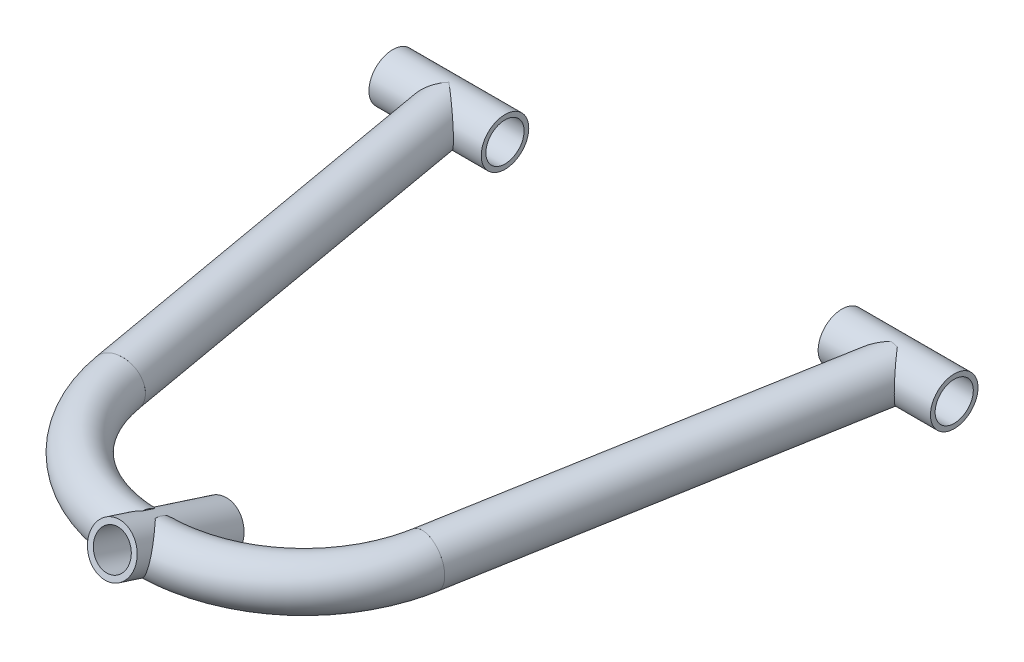
from build123d import *

# Parameters (mm, degrees)
AL_START                                       = -169.337399118
AL_ROUND_TUBING_25_4MM_OD_2_5MM_WALL_2_R       = 12.7
AL_ROUND_TUBING_25_4MM_OD_2_5MM_WALL_2_R_2     = 10.2
AL_ROUND_TUBING_25_4MM_OD_2_5MM_WALL_THI_DEPTH = 215.815587893
AL_ROUND_TUBING_25_4MM_OD_2_5MM_WALL_3_O_R     = 12.7
AL_ROUND_TUBING_25_4MM_OD_2_5MM_WALL_3_O_R_2   = 10.2
AL_ROUND_TUBING_25_4MM_OD_2_5MM_WALL_3_ANGLE   = 80
AL_ROUND_TUBING_25_4MM_OD_2_5MM_WALL_4_O_R     = 12.7
AL_ROUND_TUBING_25_4MM_OD_2_5MM_WALL_4_O_R_2   = 10.2
AL_ROUND_TUBING_25_4MM_OD_2_5MM_WALL_4_ANGLE   = 80
AL_START_2                                     = 6.947512144
AL_ROUND_TUBING_25_4MM_OD_2_5MM_WALL_5_O_R     = 12.7
AL_ROUND_TUBING_25_4MM_OD_2_5MM_WALL_5_O_R_2   = 10.2
AL_ROUND_TUBING_25_4MM_OD_2_5MM_WALL_5_DEPTH   = 217.960474667
AL_START_3                                     = 27
AL_ROUND_TUBING_25_4MM_OD_2_5MM_WALL_6_DEPTH   = 29
AL_START_4                                     = 250.00912844
AL_ROUND_TUBING_25_4MM_OD_2_5MM_WALL_7_O_R     = 12.7
AL_ROUND_TUBING_25_4MM_OD_2_5MM_WALL_7_O_R_2   = 10.2
AL_ROUND_TUBING_25_4MM_OD_2_5MM_WALL_7_DEPTH   = 60
AL_START_5                                     = 10.00912844
AL_ROUND_TUBING_25_4MM_OD_2_5MM_WALL_8_O_R     = 12.7
AL_ROUND_TUBING_25_4MM_OD_2_5MM_WALL_8_O_R_2   = 10.2
AL_ROUND_TUBING_25_4MM_OD_2_5MM_WALL_8_DEPTH   = 60
AL_START_6                                     = 156.642187893
AL_ROUND_TUBING_25_4MM_OD_2_5MM_WALL_9_O_R     = 12.7
AL_ROUND_TUBING_25_4MM_OD_2_5MM_WALL_9_O_R_2   = 10.2
AL_ROUND_TUBING_25_4MM_OD_2_5MM_WALL_9_DEPTH   = 6.733880298
SKETCH1_R                                      = 12.7
SKETCH1_R_2                                    = 9.7
AL_ROUND_TUBING_25_4MM_OD_3MM_WALL_THICK_DEPTH = 60
SKETCH111_R                                    = 9.7
CUT_EXTRUDE1_DEPTH                             = 79
SKETCH112_R                                    = 12.7
CUT_EXTRUDE2_DEPTH                             = 79
SKETCH113_R                                    = 10.7
CUT_EXTRUDE3_DEPTH                             = 79
SKETCH114_R                                    = 12.7
CUT_EXTRUDE4_DEPTH                             = 79
SKETCH151_R                                    = 12.7
SKETCH151_R_2                                  = 10.2
AL_ROUND_TUBING_25_4MM_OD_2_5MM_WALL_10_DEPTH  = 49.557519174
CUT_EXTRUDE8_DEPTH                             = 437.573037809
CUT_EXTRUDE8_DEPTH_BACK                        = 437.573037809
SKETCH152_R                                    = 12.7


with BuildPart() as part:
    # Al round tubing 25.4MM_OD_2.5MM_WALL_THI: read off the stored shape, not the designer's step
    # Al round tubing 25.4MM_OD_2.5MM_WALL 2 → Al round tubing 25.4MM_OD_2.5MM_WALL_THI (new body)
    with BuildSketch(Plane(origin=(0, 0, 0), x_dir=(0.9848077523877098, 0, 0.17364818120863598), z_dir=(0.17364818120863598, 0, -0.9848077523877098)).offset(AL_START)):
        with Locations((275.755160427, 0)):
            Circle(AL_ROUND_TUBING_25_4MM_OD_2_5MM_WALL_2_R)
        with Locations((275.755160427, 0)):
            Circle(AL_ROUND_TUBING_25_4MM_OD_2_5MM_WALL_2_R_2, mode=Mode.SUBTRACT)
    extrude(amount=AL_ROUND_TUBING_25_4MM_OD_2_5MM_WALL_THI_DEPTH)

    # Sketch113 → Cut-Extrude3 (cut)
    with BuildSketch(Plane(origin=(310.00912844, 0, 0), x_dir=(0, 0, -1), z_dir=(1, 0, 0))):
        Circle(SKETCH113_R)
    extrude(amount=-CUT_EXTRUDE3_DEPTH, mode=Mode.SUBTRACT)

    # Sketch114 → Cut-Extrude4 (cut)
    with BuildSketch(Plane(origin=(310.00912844, 0, 0), x_dir=(0, 0, -1), z_dir=(1, 0, 0))):
        Circle(SKETCH114_R)
    extrude(amount=-CUT_EXTRUDE4_DEPTH, mode=Mode.SUBTRACT)


with BuildPart() as body_2:
    # Al round tubing 25.4MM_OD_2.5MM_WALL 3 o → Al round tubing 25.4MM_OD_2.5MM_WALL 3 (revolve)
    with BuildSketch(Plane(origin=(163.376068191, 0, 200.757310991), x_dir=(0, 0, 1), z_dir=(-1, 0, 0))):
        with Locations((80, 0)):
            Circle(AL_ROUND_TUBING_25_4MM_OD_2_5MM_WALL_3_O_R)
        with Locations((80, 0)):
            Circle(AL_ROUND_TUBING_25_4MM_OD_2_5MM_WALL_3_O_R_2, mode=Mode.SUBTRACT)
    revolve(axis=Axis((163.376068191, 0, 200.757310991), (0, 1, 0)), revolution_arc=AL_ROUND_TUBING_25_4MM_OD_2_5MM_WALL_3_ANGLE)


with BuildPart() as body_3:
    # Al round tubing 25.4MM_OD_2.5MM_WALL 4 o → Al round tubing 25.4MM_OD_2.5MM_WALL 4 (revolve)
    with BuildSketch(Plane(origin=(156.642187893, 0, 200.757310991), x_dir=(-0.9848077530122088, 0, 0.1736481776669259), z_dir=(-0.1736481776669259, 0, -0.9848077530122088))):
        with Locations((80, 0)):
            Circle(AL_ROUND_TUBING_25_4MM_OD_2_5MM_WALL_4_O_R)
        with Locations((80, 0)):
            Circle(AL_ROUND_TUBING_25_4MM_OD_2_5MM_WALL_4_O_R_2, mode=Mode.SUBTRACT)
    revolve(axis=Axis((156.642187893, 0, 200.757310991), (0, 1, 0)), revolution_arc=AL_ROUND_TUBING_25_4MM_OD_2_5MM_WALL_4_ANGLE)


with BuildPart() as body_4:
    # Al round tubing 25.4MM_OD_2.5MM_WALL 5 o → Al round tubing 25.4MM_OD_2.5MM_WALL 5 (new body)
    with BuildSketch(Plane(origin=(0, 0, 0), x_dir=(0.9848077530122086, 0, -0.173648177666927), z_dir=(0.17364817766692697, 0, 0.9848077530122088)).offset(AL_START_2)):
        with Locations((39.401299879, 0)):
            Circle(AL_ROUND_TUBING_25_4MM_OD_2_5MM_WALL_5_O_R)
        with Locations((39.401299879, 0)):
            Circle(AL_ROUND_TUBING_25_4MM_OD_2_5MM_WALL_5_O_R_2, mode=Mode.SUBTRACT)
    extrude(amount=AL_ROUND_TUBING_25_4MM_OD_2_5MM_WALL_5_DEPTH)

    # Al round tubing 25.4MM_OD_2.5MM_WALL 6 o → Al round tubing 25.4MM_OD_2.5MM_WALL 6 (cut)
    with BuildSketch(Plane.YZ.offset(AL_START_3)):
        with BuildLine():
            ThreePointArc((12.7, 0), (0, 12.7), (-12.7, 0))
            Line((-12.7, 0), (-12.7, -4))
            Line((-12.7, -4), (12.7, -4))
            Line((12.7, -4), (12.7, 0))
        make_face()
    extrude(amount=AL_ROUND_TUBING_25_4MM_OD_2_5MM_WALL_6_DEPTH, mode=Mode.SUBTRACT)


with BuildPart() as body_5:
    # Al round tubing 25.4MM_OD_2.5MM_WALL 7 o → Al round tubing 25.4MM_OD_2.5MM_WALL 7 (new body)
    with BuildSketch(Plane.YZ.offset(AL_START_4)):
        Circle(AL_ROUND_TUBING_25_4MM_OD_2_5MM_WALL_7_O_R)
        Circle(AL_ROUND_TUBING_25_4MM_OD_2_5MM_WALL_7_O_R_2, mode=Mode.SUBTRACT)
    extrude(amount=AL_ROUND_TUBING_25_4MM_OD_2_5MM_WALL_7_DEPTH)


with BuildPart() as body_6:
    # Al round tubing 25.4MM_OD_2.5MM_WALL 8 o → Al round tubing 25.4MM_OD_2.5MM_WALL 8 (new body)
    with BuildSketch(Plane.YZ.offset(AL_START_5)):
        Circle(AL_ROUND_TUBING_25_4MM_OD_2_5MM_WALL_8_O_R)
        Circle(AL_ROUND_TUBING_25_4MM_OD_2_5MM_WALL_8_O_R_2, mode=Mode.SUBTRACT)
    extrude(amount=AL_ROUND_TUBING_25_4MM_OD_2_5MM_WALL_8_DEPTH)


with BuildPart() as body_7:
    # Al round tubing 25.4MM_OD_2.5MM_WALL 9 o → Al round tubing 25.4MM_OD_2.5MM_WALL 9 (new body)
    with BuildSketch(Plane.YZ.offset(AL_START_6)):
        with Locations((0, 280.757310991)):
            Circle(AL_ROUND_TUBING_25_4MM_OD_2_5MM_WALL_9_O_R)
        with Locations((0, 280.757310991)):
            Circle(AL_ROUND_TUBING_25_4MM_OD_2_5MM_WALL_9_O_R_2, mode=Mode.SUBTRACT)
    extrude(amount=AL_ROUND_TUBING_25_4MM_OD_2_5MM_WALL_9_DEPTH)


with BuildPart() as body_8:
    # Sketch1 → Al round tubing 25.4MM_OD_3MM_WALL_THICKNESS(2) (new body)
    with BuildSketch(Plane(origin=(160.00912844, 6.133072583, 299.793734518), x_dir=(1, 0, 0), z_dir=(0, -0.3066536291337132, -0.9518211763451805))):
        Circle(SKETCH1_R)
        Circle(SKETCH1_R_2, mode=Mode.SUBTRACT)
    extrude(amount=AL_ROUND_TUBING_25_4MM_OD_3MM_WALL_THICK_DEPTH)


with BuildPart() as cut_extrude1_tool:
    # Sketch111 → Cut-Extrude1 (new body)
    with BuildSketch(Plane(origin=(0, 88.080353118, 273.392314169), x_dir=(1, 0, 0), z_dir=(0, 0.3066536291337132, 0.9518211763451805))):
        with Locations(Location((160.00912844, -86.095248321, 0), (0, 0, 90))):
            Circle(SKETCH111_R)
    extrude(amount=-CUT_EXTRUDE1_DEPTH)


with BuildPart() as body_2_1:
    add(body_2.part)

    # Cut-Extrude1: cut by cut_extrude1_tool
    add(cut_extrude1_tool.part, mode=Mode.SUBTRACT)


with BuildPart() as body_3_1:
    add(body_3.part)

    # Cut-Extrude1: cut by cut_extrude1_tool
    add(cut_extrude1_tool.part, mode=Mode.SUBTRACT)


with BuildPart() as body_7_1:
    add(body_7.part)

    # Cut-Extrude1: cut by cut_extrude1_tool
    add(cut_extrude1_tool.part, mode=Mode.SUBTRACT)


with BuildPart() as cut_extrude2_tool:
    # Sketch112 → Cut-Extrude2 (new body)
    with BuildSketch(Plane(origin=(0, 88.080353118, 273.392314169), x_dir=(1, 0, 0), z_dir=(0, 0.3066536291337132, 0.9518211763451805))):
        with Locations(Location((160.00912844, -86.095248321, 0), (0, 0, 90))):
            Circle(SKETCH112_R)
    extrude(amount=-CUT_EXTRUDE2_DEPTH)


with BuildPart() as body_2_2:
    add(body_2_1.part)

    # Cut-Extrude2: cut by cut_extrude2_tool
    add(cut_extrude2_tool.part, mode=Mode.SUBTRACT)


with BuildPart() as body_3_2:
    add(body_3_1.part)

    # Cut-Extrude2: cut by cut_extrude2_tool
    add(cut_extrude2_tool.part, mode=Mode.SUBTRACT)


with BuildPart() as body_9:
    # Sketch151 → Al round tubing 25.4MM_OD_2.5MM_WALL 10 (new body)
    with BuildSketch(Plane(origin=(163.376068191, 0, 280.757310991), x_dir=(0, 0, -1), z_dir=(1, 0, 0))):
        Circle(SKETCH151_R)
        Circle(SKETCH151_R_2, mode=Mode.SUBTRACT)
    extrude(amount=AL_ROUND_TUBING_25_4MM_OD_2_5MM_WALL_10_DEPTH)

    # Sketch152 → Cut-Extrude8 (cut, two sides: drawn at the far end of the back side and taken through both)
    with BuildSketch(Plane(origin=(0, 88.080353118, 273.392314169), x_dir=(1, 0, 0), z_dir=(0, 0.3066536291337132, 0.9518211763451805)).offset(-CUT_EXTRUDE8_DEPTH_BACK)):
        with Locations(Location((160.00912844, -86.095248321, 0), (0, 0, 90))):
            Circle(SKETCH152_R)
    extrude(amount=CUT_EXTRUDE8_DEPTH + CUT_EXTRUDE8_DEPTH_BACK, mode=Mode.SUBTRACT)


solid = Compound([part.part, body_4.part, body_5.part, body_6.part, body_8.part, body_2_2.part, body_3_2.part])
